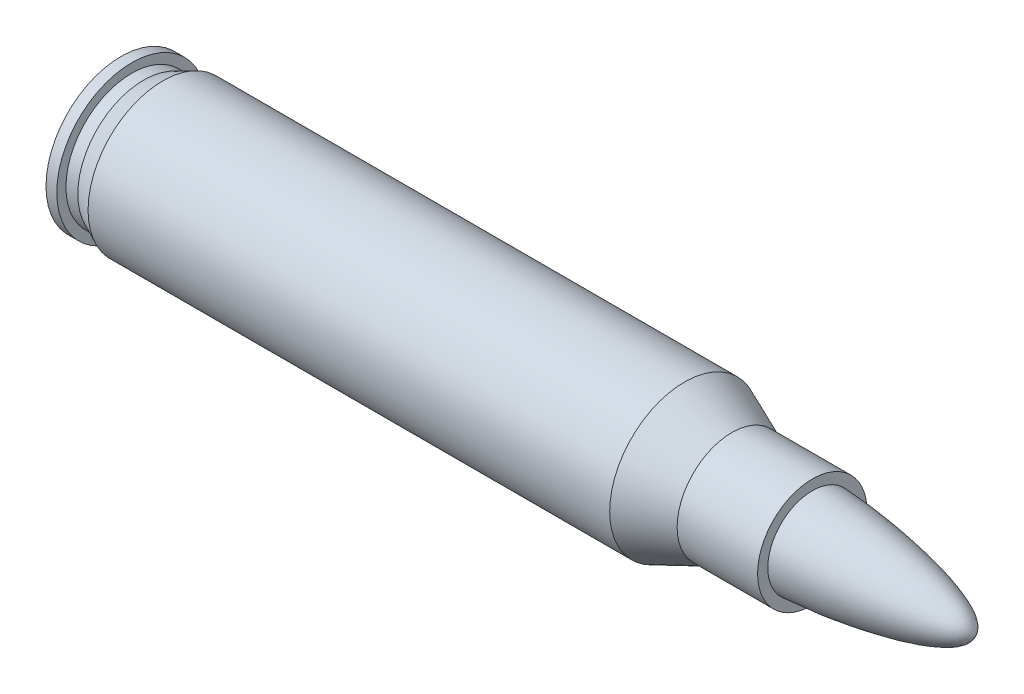
from build123d import *


with BuildPart() as part:
    # Sketch4 → Revolve1 (revolve)
    with BuildSketch(Plane(origin=(0, 0, 0), x_dir=(1, 0, 0), z_dir=(0, 1, 0))):
        with BuildLine():
            Line((39.55, 3.502399726), (36.52, 4.78855842))
            Line((36.52, 4.78855842), (3.13, 4.78855842))
            Line((3.13, 4.78855842), (1.9, 4.215))
            Line((1.9, 4.215), (1.14, 4.215))
            Line((1.14, 4.215), (1.14, 4.8))
            Line((1.14, 4.8), (0.45, 4.8))
            Line((0.45, 4.8), (0, 4.157333397))
            Line((0, 4.157333397), (0, 0))
            Line((0, 0), (55.042779561, 0))
            add(Edge.make_bspline(
                [(44.7, 2.85), (45.695890655, 2.802186442), (47.113210669, 2.665506029), (49.026360233, 2.385672525), (50.989676721, 2.035959499), (52.835043323, 1.588163658), (54.223064197, 0.981758109), (54.65927729, 0.662706923), (54.90073162, 0.378277242), (55.012308549, 0.153900443), (55.042779561, 0)],
                knots=[0, 0, 0, 0, 0.270565149, 0.386221319, 0.524695043, 0.812071716, 0.899191308, 0.93355491, 0.957542112, 1, 1, 1, 1], degree=3))
            Line((44.7, 2.85), (44.7, 3.502399726))
            Line((44.7, 3.502399726), (39.55, 3.502399726))
        make_face()
    revolve(axis=Axis((0, 0, 0), (1, 0, 0)))


solid = part.part
